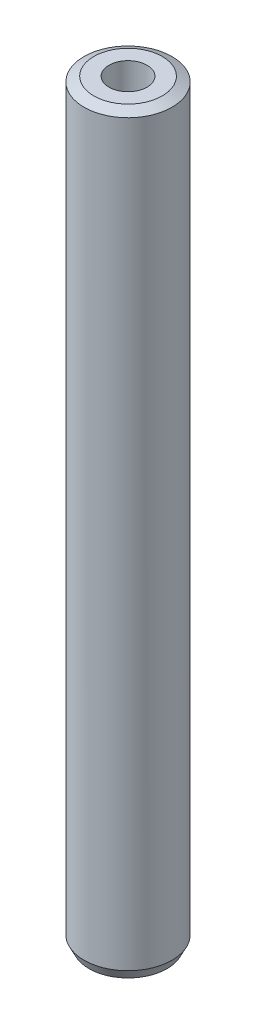
from build123d import *
from OCP.BRepFilletAPI import BRepFilletAPI_MakeChamfer

# Parameters (mm, degrees)
SKETCH1_R           = 5
BOSS_EXTRUDE1_DEPTH = 85.660262691
SKETCH2_R           = 2.166037424
CUT_EXTRUDE1_DEPTH  = 86.951617811
CHAMFER1_SIZE       = 0.559244631
CHAMFER1_SIZE2      = 1.11116018


with BuildPart() as part:
    # Sketch1 → Boss-Extrude1 (new body)
    with BuildSketch(Plane(origin=(0, 0, 0), x_dir=(1, 0, 0), z_dir=(0, 1, 0))):
        Circle(SKETCH1_R)
    extrude(amount=BOSS_EXTRUDE1_DEPTH)

    # Sketch2 → Cut-Extrude1 (cut, through all)
    with BuildSketch(Plane(origin=(0, 0, 0), x_dir=(1, 0, 0), z_dir=(0, 1, 0))):
        Circle(SKETCH2_R)
    extrude(amount=CUT_EXTRUDE1_DEPTH, mode=Mode.SUBTRACT)

    # Chamfer1: one chamfer whose edges measure the first distance from different faces: ONE call of the kernel's chamfer builder (chamfer() names one face for all edges)
    chamfer1_edges_1 = [part.edges().sort_by_distance(p)[0] for p in [
        (-5, 85.660262691, 0),
    ]]
    chamfer1_side_1 = [part.faces().sort_by_distance(p)[0] for p in [
        (-5, 42.830131346, 0),
    ]]
    chamfer1_edges_2 = [part.edges().sort_by_distance(p)[0] for p in [
        (-5, 0, 0),
    ]]
    chamfer1_side_2 = [part.faces().sort_by_distance(p)[0] for p in [
        (-4.858578644, 0, 0),
    ]]
    chamfer1 = BRepFilletAPI_MakeChamfer(part.part.solid().wrapped)
    for e in chamfer1_edges_1:
        chamfer1.Add(CHAMFER1_SIZE, CHAMFER1_SIZE2, e.wrapped, chamfer1_side_1[0].wrapped)  # the first distance lies on this face
    for e in chamfer1_edges_2:
        chamfer1.Add(CHAMFER1_SIZE, CHAMFER1_SIZE2, e.wrapped, chamfer1_side_2[0].wrapped)  # the first distance lies on this face
    add(Compound.cast(chamfer1.Shape()), mode=Mode.REPLACE)


solid = part.part
